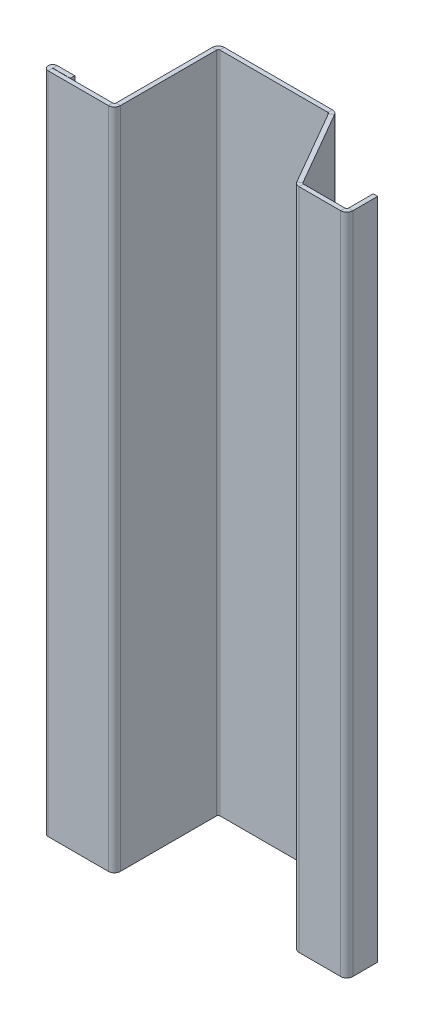
from build123d import *

# Parameters (mm, degrees)
SCHIZZO2_W                     = 50
SCHIZZO2_H                     = 300
BASE_FLANGIA2_DEPTH            = 2
BORDO_FLANGIA1_STRIP_W         = 9.4732
BORDO_FLANGIA1_STRIP_H         = 2
BORDO_FLANGIA1_STRIP_CUT_DEPTH = 300
BORDO_FLANGIA1_DEPTH           = 300
BORDO_FLANGIA2_STRIP_W         = 9.4732
BORDO_FLANGIA2_STRIP_H         = 2
BORDO_FLANGIA2_STRIP_CUT_DEPTH = 300
BORDO_FLANGIA2_DEPTH           = 300
BORDO_FLANGIA3_STRIP_CUT_DEPTH = 300
BORDO_FLANGIA3_DEPTH           = 300
BORDO_FLANGIA4_STRIP_CUT_DEPTH = 300
BORDO_FLANGIA4_DEPTH           = 300
BORDO_FLANGIA5_STRIP_W         = 9.4732
BORDO_FLANGIA5_STRIP_H         = 2
BORDO_FLANGIA5_STRIP_CUT_DEPTH = 300
BORDO_FLANGIA5_DEPTH           = 300
ORLO1_START                    = -150
ORLO1_DEPTH                    = 300
ORLO1_2_DEPTH                  = 300


# Read off the part's stored shape, not the designer's step: Orlo1
# Sheet-metal steps are written as plain solids
with BuildPart() as part:
    # Schizzo2 → Base-Flangia2 (new body)
    with BuildSketch(Plane.XY):
        Rectangle(SCHIZZO2_W, SCHIZZO2_H)
    extrude(amount=-BASE_FLANGIA2_DEPTH)

    # Bordo-Flangia1 strip (across the edge) → Bordo-Flangia1 strip cut (cut)
    with BuildSketch(Plane(origin=(-25, 150, 0), x_dir=(1, 0, 0), z_dir=(0, -1, 0))):
        with Locations((-4, -1)):
            Rectangle(BORDO_FLANGIA1_STRIP_W, BORDO_FLANGIA1_STRIP_H)
    extrude(amount=BORDO_FLANGIA1_STRIP_CUT_DEPTH, mode=Mode.SUBTRACT)

    # Bordo-Flangia1 section (across the edge) → Bordo-Flangia1 (add)
    with BuildSketch(Plane(origin=(-25, 150, 0), x_dir=(1, 0, 0), z_dir=(0, -1, 0))):
        with BuildLine():
            Line((-2, 0.7366), (-2, 45))
            Line((-2, 45), (0, 45))
            Line((0, 45), (0, 0.7366))
            ThreePointArc((0, 0.7366), (0.215745145, 0.215745145), (0.7366, 0))
            Line((0.7366, 0), (0.7366, -2))
            ThreePointArc((0.7366, -2), (-1.198468417, -1.198468417), (-2, 0.7366))
        make_face()
    extrude(amount=BORDO_FLANGIA1_DEPTH)

    # Bordo-Flangia2 strip (across the edge) → Bordo-Flangia2 strip cut (cut)
    with BuildSketch(Plane(origin=(-27, -150, 45), x_dir=(0, 0, -1), z_dir=(0, 1, 0))):
        with Locations((-4, -1)):
            Rectangle(BORDO_FLANGIA2_STRIP_W, BORDO_FLANGIA2_STRIP_H)
    extrude(amount=BORDO_FLANGIA2_STRIP_CUT_DEPTH, mode=Mode.SUBTRACT)

    # Bordo-Flangia2 section (across the edge) → Bordo-Flangia2 (add)
    with BuildSketch(Plane(origin=(-27, -150, 45), x_dir=(0, 0, -1), z_dir=(0, 1, 0))):
        with BuildLine():
            Line((-2, 0.7366), (-2, 30))
            Line((-2, 30), (0, 30))
            Line((0, 30), (0, 0.7366))
            ThreePointArc((0, 0.7366), (0.215745145, 0.215745145), (0.7366, 0))
            Line((0.7366, 0), (0.7366, -2))
            ThreePointArc((0.7366, -2), (-1.198468417, -1.198468417), (-2, 0.7366))
        make_face()
    extrude(amount=BORDO_FLANGIA2_DEPTH)

    # Bordo-Flangia3 strip (across the edge) → Bordo-Flangia3 strip cut (cut)
    with BuildSketch(Plane(origin=(25, -150, 0), x_dir=(-0.8660254037844364, 0, 0.5000000000000041), z_dir=(0, 1, 0))):
        Polygon((-8.835731855, 2.791911088), (-0.6317, -1.944688912), (0.3683, -0.212638104), (-7.835731855, 4.523961896), align=None)
    extrude(amount=BORDO_FLANGIA3_STRIP_CUT_DEPTH, mode=Mode.SUBTRACT)

    # Bordo-Flangia3 section (across the edge) → Bordo-Flangia3 (add)
    with BuildSketch(Plane(origin=(25, -150, 0), x_dir=(-0.8660254037844364, 0, 0.5000000000000041), z_dir=(0, 1, 0))):
        with BuildLine():
            Line((-2, 0.425276208), (-2, 40))
            Line((-2, 40), (0, 40))
            Line((0, 40), (0, 0.425276208))
            ThreePointArc((0, 0.425276208), (0.098685688, 0.056976208), (0.3683, -0.212638104))
            Line((0.3683, -0.212638104), (-0.6317, -1.944688912))
            ThreePointArc((-0.6317, -1.944688912), (-1.63336512, -0.943023792), (-2, 0.425276208))
        make_face()
    extrude(amount=BORDO_FLANGIA3_DEPTH)

    # Bordo-Flangia4 strip (across the edge) → Bordo-Flangia4 strip cut (cut)
    with BuildSketch(Plane(origin=(46.732050808, 150, 33.641016151), x_dir=(0, 0, -1), z_dir=(0, -1, 0))):
        Polygon((-8.835731855, 2.791911088), (-0.6317, -1.944688912), (0.3683, -0.212638104), (-7.835731855, 4.523961896), align=None)
    extrude(amount=BORDO_FLANGIA4_STRIP_CUT_DEPTH, mode=Mode.SUBTRACT)

    # Bordo-Flangia4 section (across the edge) → Bordo-Flangia4 (add)
    with BuildSketch(Plane(origin=(46.732050808, 150, 33.641016151), x_dir=(0, 0, -1), z_dir=(0, -1, 0))):
        with BuildLine():
            Line((-2, 0.425276208), (-2, 20))
            Line((-2, 20), (0, 20))
            Line((0, 20), (0, 0.425276208))
            ThreePointArc((0, 0.425276208), (0.098685688, 0.056976208), (0.3683, -0.212638104))
            Line((0.3683, -0.212638104), (-0.6317, -1.944688912))
            ThreePointArc((-0.6317, -1.944688912), (-1.63336512, -0.943023792), (-2, 0.425276208))
        make_face()
    extrude(amount=BORDO_FLANGIA4_DEPTH)

    # Bordo-Flangia5 strip (across the edge) → Bordo-Flangia5 strip cut (cut)
    with BuildSketch(Plane(origin=(66.732050808, 150, 33.641016151), x_dir=(-1, 0, 0), z_dir=(0, -1, 0))):
        with Locations((-4, -1)):
            Rectangle(BORDO_FLANGIA5_STRIP_W, BORDO_FLANGIA5_STRIP_H)
    extrude(amount=BORDO_FLANGIA5_STRIP_CUT_DEPTH, mode=Mode.SUBTRACT)

    # Bordo-Flangia5 section (across the edge) → Bordo-Flangia5 (add)
    with BuildSketch(Plane(origin=(66.732050808, 150, 33.641016151), x_dir=(-1, 0, 0), z_dir=(0, -1, 0))):
        with BuildLine():
            Line((-2, 0.7366), (-2, 12))
            Line((-2, 12), (0, 12))
            Line((0, 12), (0, 0.7366))
            ThreePointArc((0, 0.7366), (0.215745145, 0.215745145), (0.7366, 0))
            Line((0.7366, 0), (0.7366, -2))
            ThreePointArc((0.7366, -2), (-1.198468417, -1.198468417), (-2, 0.7366))
        make_face()
    extrude(amount=BORDO_FLANGIA5_DEPTH)

    # Orlo1 outline → Orlo1 (cut)
    with BuildSketch(Plane(origin=(0, 0, 0), x_dir=(1, 0, 0), z_dir=(0, 1, 0)).offset(ORLO1_START)):
        with BuildLine():
            ThreePointArc((-54.95, -47), (-56.381782106, -46.417140075), (-56.999390153, -45))
            Line((-56.999390153, -45), (-57, -45))
            Line((-57, -45), (-57, -47))
            Line((-57, -47), (-54.95, -47))
        make_face()
    extrude(amount=ORLO1_DEPTH, mode=Mode.SUBTRACT)

    # Orlo1 2 outline → Orlo1 2 (add)
    with BuildSketch(Plane(origin=(0, 0, 0), x_dir=(1, 0, 0), z_dir=(0, 1, 0)).offset(ORLO1_START)):
        with BuildLine():
            Line((-47, -44.9), (-47, -42.9))
            Line((-47, -42.9), (-54.95, -42.9))
            ThreePointArc((-54.95, -42.9), (-56.417140075, -43.518217894), (-56.999390153, -45))
            Line((-56.999390153, -45), (-54.95, -45))
            ThreePointArc((-54.95, -45), (-55, -44.95), (-54.95, -44.9))
            Line((-54.95, -44.9), (-47, -44.9))
        make_face()
    extrude(amount=ORLO1_2_DEPTH)


solid = part.part
